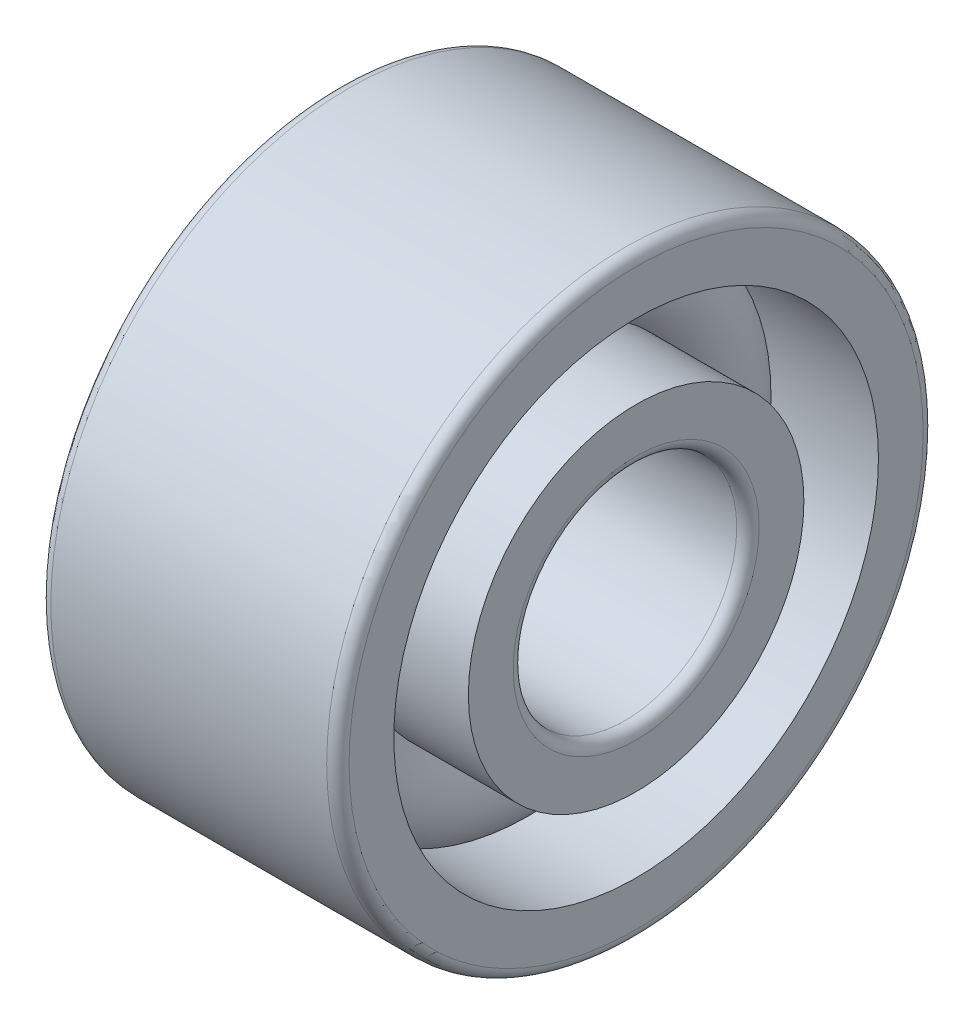
from build123d import *

# Parameters (mm, degrees)
CAGSPISKE_W     = 0.15
CAGSPISKE_H     = 0.25
CAGESPINE_ANGLE = 0.001
BALSIMSKE_R     = 0.75


with BuildPart() as part:
    # CagSpiSke → CageSpine (revolve)
    with BuildSketch(Plane.XY):
        with Locations((0, 2.75)):
            Rectangle(CAGSPISKE_W, CAGSPISKE_H)
    revolve(axis=Axis((-20.6375, 0, 0), (-1, 0, 0)), revolution_arc=CAGESPINE_ANGLE)

    # BalSimSke → BallsSimplified (revolve)
    with BuildSketch(Plane.XY):
        with Locations((0, 2.75)):
            Circle(BALSIMSKE_R)
    revolve(axis=Axis((-10, 0, 0), (1, 0, 0)))

    # InnRacSke → InnerRace (revolve)
    with BuildSketch(Plane.XY):
        with BuildLine():
            Line((-0.525, 2.25), (-2, 2.25))
            Line((-2, 2.25), (-2, 1.65))
            ThreePointArc((-2, 1.65), (-1.956066017, 1.543933983), (-1.85, 1.5))
            Line((-1.85, 1.5), (1.85, 1.5))
            ThreePointArc((1.85, 1.5), (1.956066017, 1.543933983), (2, 1.65))
            Line((2, 1.65), (2, 2.25))
            Line((2, 2.25), (0.525, 2.25))
            ThreePointArc((0.525, 2.25), (0, 2.025), (-0.525, 2.25))
        make_face()
    revolve(axis=Axis((-20.6375, 0, 0), (1, 0, 0)))

    # OutRacSke → OuterRace (revolve)
    with BuildSketch(Plane.XY):
        with BuildLine():
            Line((-0.525, 3.25), (-2, 3.25))
            Line((-2, 3.25), (-2, 3.85))
            ThreePointArc((-2, 3.85), (-1.956066017, 3.956066017), (-1.85, 4))
            Line((-1.85, 4), (1.85, 4))
            ThreePointArc((1.85, 4), (1.956066017, 3.956066017), (2, 3.85))
            Line((2, 3.85), (2, 3.25))
            Line((2, 3.25), (0.525, 3.25))
            ThreePointArc((0.525, 3.25), (0, 3.475), (-0.525, 3.25))
        make_face()
    revolve(axis=Axis((-20.6375, 0, 0), (1, 0, 0)))


solid = part.part
